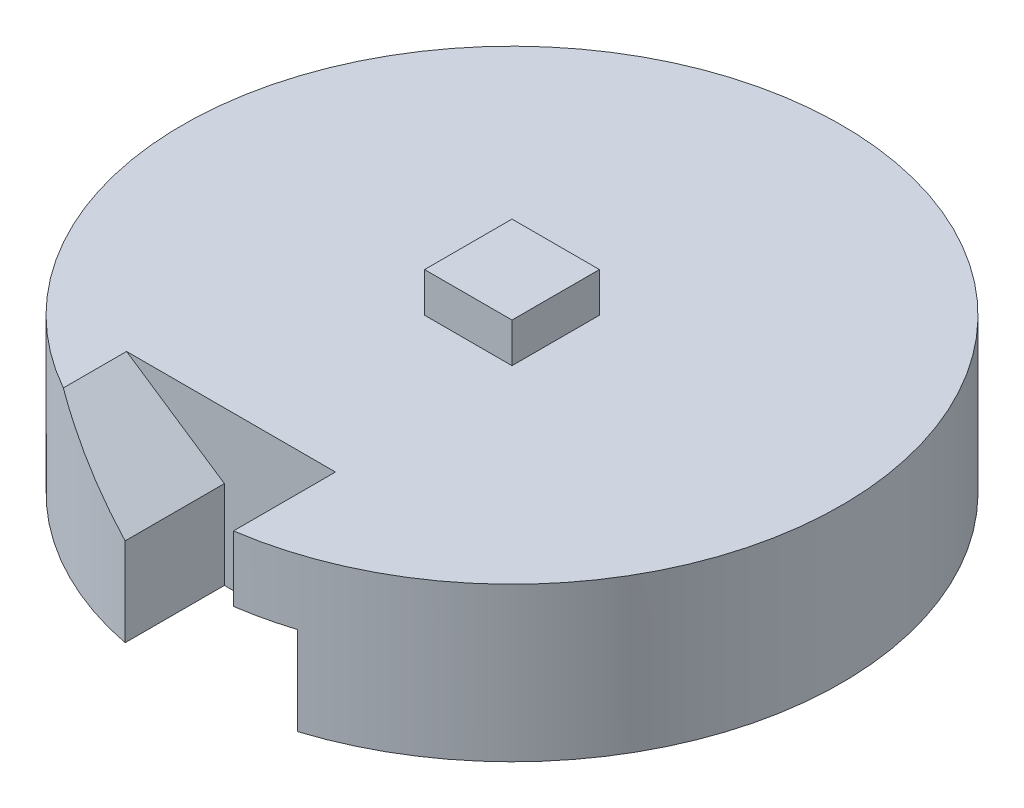
from build123d import *

# Parameters (mm, degrees)
SKETCH1_R           = 37.5
BOSS_EXTRUDE1_DEPTH = 17.5
CUT_EXTRUDE3_DEPTH  = 12
SKETCH9_W           = 9.95
SKETCH9_H           = 9.95
BOSS_EXTRUDE2_DEPTH = 22
SKETCH2_R           = 5
BOSS_EXTRUDE3_DEPTH = 10
CUT_EXTRUDE5_DEPTH  = 10


with BuildPart() as part:
    # Sketch1 → Boss-Extrude1 (new body)
    with BuildSketch(Plane(origin=(0, 0, 0), x_dir=(1, 0, 0), z_dir=(0, 1, 0))):
        Circle(SKETCH1_R)
    extrude(amount=BOSS_EXTRUDE1_DEPTH)

    # Sketch7 → Cut-Extrude3 (cut)
    with BuildSketch(Plane.XY.offset(37.5)):
        Polygon((5.409167976, 17.669921883), (-18.615329351, 17.669921883), (-7.232029952, 10.040131917), (-7.232029952, -0.186148413), (11.337754855, -0.186148413), (11.337754855, 10.05869391), (5.409167976, 10.05869391), align=None)
    extrude(amount=-CUT_EXTRUDE3_DEPTH, mode=Mode.SUBTRACT)

    # Sketch9 → Boss-Extrude2 (add)
    with BuildSketch(Plane(origin=(0, 0, 0), x_dir=(1, 0, 0), z_dir=(0, 1, 0))):
        Rectangle(SKETCH9_W, SKETCH9_H)
    extrude(amount=BOSS_EXTRUDE2_DEPTH)

    # Sketch2 → Boss-Extrude3 (add)
    with BuildSketch(Plane.XZ):
        Circle(SKETCH2_R)
    extrude(amount=BOSS_EXTRUDE3_DEPTH)

    # Sketch11 → Cut-Extrude5 (cut)
    with BuildSketch(Plane.XZ.offset(10)):
        with BuildLine():
            Line((0.018011531, -1.443232403), (0.565734089, -1.443232403))
            ThreePointArc((0.565734089, -1.443232403), (0.018011531, 1.556767597), (-0.529711026, -1.443232403))
            Line((-0.529711026, -1.443232403), (0.018011531, -1.443232403))
        make_face()
    extrude(amount=-CUT_EXTRUDE5_DEPTH, mode=Mode.SUBTRACT)


solid = part.part
